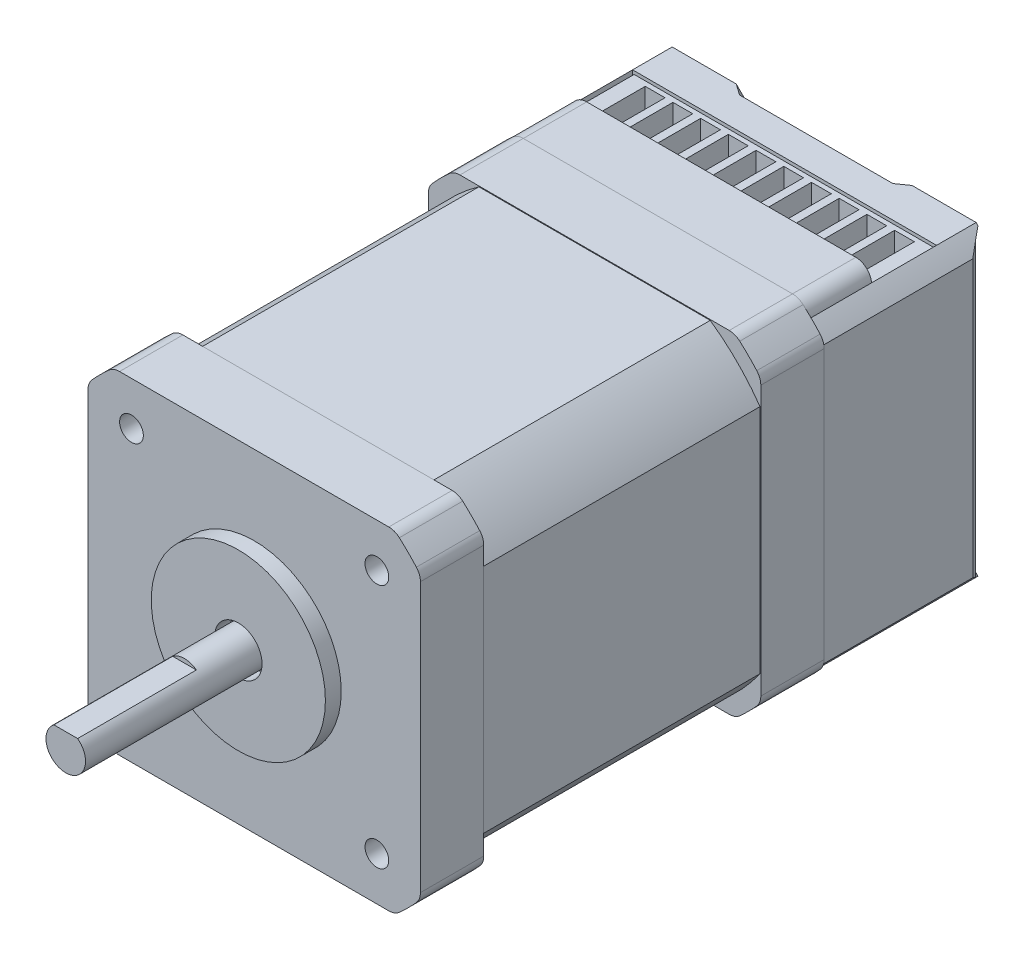
from build123d import *

# Parameters (mm, degrees)
SKIZZE1_W                            = 42
SKIZZE1_H                            = 42
AUFSATZ_LINEAR_AUSTRAGEN1_DEPTH      = 25.5
SKIZZE3_R                            = 11
SKIZZE3_R_2                          = 3
AUFSATZ_LINEAR_AUSTRAGEN2_DEPTH      = 2
SKIZZE5_R                            = 1.5
SCHNITT_LINEAR_AUSTRAGEN2_DEPTH      = 10
AUFSATZ_LINEAR_AUSTRAGEN3_DEPTH      = 21.8
AUFSATZ_LINEAR_AUSTRAGEN3_DEPTH_BACK = 10
SKIZZE6_R                            = 2.5
SKIZZE10_W                           = 14.352369787
SKIZZE10_H                           = 9.568246525
SCHNITT_LINEAR_AUSTRAGEN4_DEPTH      = 15
SKIZZE2_OUTSIDE_W                    = 63.102
SKIZZE2_OUTSIDE_H                    = 63.102
SKIZZE2_OUTSIDE_R                    = 27.5
SCHNITT_LINEAR_AUSTRAGEN5_DEPTH      = 60.016946719
SCHNITT_LINEAR_START                 = -8
SKIZZE11_R                           = 28.22533159
SCHNITT_LINEAR_AUSTRAGEN6_DEPTH      = 35
VERRUNDUNG1_R                        = 2
SKIZZE12_W                           = 38
SKIZZE12_H                           = 15
AUFSATZ_LINEAR_AUSTRAGEN4_DEPTH      = 8
VERRUNDUNG2_R                        = 2
SKIZZE13_W                           = 38
SKIZZE13_H                           = 13
AUFSATZ_LINEAR_AUSTRAGEN5_DEPTH      = 8
SKIZZE15_W                           = 2.5
SKIZZE15_H                           = 6.8
SCHNITT_LINEAR_AUSTRAGEN7_DEPTH      = 8
LINEARES_MUSTER1_COUNT               = 5
LINEARES_MUSTER1_PITCH               = 3.5
SPIEGELN1_COPY_1_SKETCH_W            = 2.5
SPIEGELN1_COPY_1_SKETCH_H            = 6.8
SPIEGELN1_COPY_1_DEPTH               = 8
SPIEGELN1_COPY_2_SKETCH_W            = 2.5
SPIEGELN1_COPY_2_SKETCH_H            = 6.8
SPIEGELN1_COPY_2_DEPTH               = 8
SPIEGELN1_COPY_3_SKETCH_W            = 2.5
SPIEGELN1_COPY_3_SKETCH_H            = 6.8
SPIEGELN1_COPY_3_DEPTH               = 8
SPIEGELN1_COPY_4_SKETCH_W            = 2.5
SPIEGELN1_COPY_4_SKETCH_H            = 6.8
SPIEGELN1_COPY_4_DEPTH               = 8
AUFSATZ_LINEAR_AUSTRAGEN6_DEPTH      = 16
AUFSATZ_LINEAR_AUSTRAGEN7_DEPTH      = 5
SCHNITT_LINEAR_AUSTRAGEN8_DEPTH      = 1
AUFSATZ_LINEAR_AUSTRAGEN8_DEPTH      = 1
SCHNITT_LINEAR_AUSTRAGEN9_DEPTH      = 1
FASE1_SIZE                           = 1
SCHNITT_LINEAR_AUSTRAGEN10_DEPTH     = 68.113738214
SKIZZE22_R                           = 3
SCHNITT_LINEAR_AUSTRAGEN11_DEPTH     = 2


with BuildPart() as part:
    # Skizze1 → Aufsatz-Linear austragen1 (new, symmetric)
    with BuildSketch(Plane.XY):
        Rectangle(SKIZZE1_W, SKIZZE1_H)
    extrude(amount=AUFSATZ_LINEAR_AUSTRAGEN1_DEPTH, both=True)

    # Skizze3 → Aufsatz-Linear austragen2 (add)
    with BuildSketch(Plane.XY.offset(25.5)):
        Circle(SKIZZE3_R)
        Circle(SKIZZE3_R_2, mode=Mode.SUBTRACT)
    extrude(amount=AUFSATZ_LINEAR_AUSTRAGEN2_DEPTH)

    # Skizze5 → Schnitt-Linear austragen2 (cut)
    with BuildSketch(Plane.XY.offset(25.5)):
        with Locations((-15.5, 15.5)):
            Circle(SKIZZE5_R)
        with Locations((15.5, 15.5)):
            Circle(SKIZZE5_R)
        with Locations((-15.5, -15.5)):
            Circle(SKIZZE5_R)
        with Locations((15.5, -15.5)):
            Circle(SKIZZE5_R)
    extrude(amount=-SCHNITT_LINEAR_AUSTRAGEN2_DEPTH, mode=Mode.SUBTRACT)

    # Skizze6 → Aufsatz-Linear austragen3 (add, two sides: drawn at the far end of the back side and taken through both)
    with BuildSketch(Plane.XY.offset(27.5).offset(-AUFSATZ_LINEAR_AUSTRAGEN3_DEPTH_BACK)):
        Circle(SKIZZE6_R)
    extrude(amount=AUFSATZ_LINEAR_AUSTRAGEN3_DEPTH + AUFSATZ_LINEAR_AUSTRAGEN3_DEPTH_BACK)

    # Skizze10 → Schnitt-Linear austragen4 (cut)
    with BuildSketch(Plane.XY.offset(49.3)):
        with Locations((0.401216994, 6.784123263)):
            Rectangle(SKIZZE10_W, SKIZZE10_H)
    extrude(amount=-SCHNITT_LINEAR_AUSTRAGEN4_DEPTH, mode=Mode.SUBTRACT)

    # Skizze2 outside → Schnitt-Linear austragen5 (cut, through all)
    with BuildSketch(Plane.XY.offset(25.5)):
        Rectangle(SKIZZE2_OUTSIDE_W, SKIZZE2_OUTSIDE_H)
        Circle(SKIZZE2_OUTSIDE_R, mode=Mode.SUBTRACT)
    extrude(amount=-SCHNITT_LINEAR_AUSTRAGEN5_DEPTH, mode=Mode.SUBTRACT)

    # Skizze11 → Schnitt-Linear austragen6 (cut)
    with BuildSketch(Plane.XY.offset(25.5).offset(SCHNITT_LINEAR_START)):
        Circle(SKIZZE11_R)
        with BuildLine():
            Line((-14.609585894, 20.9), (14.609585894, 20.9))
            ThreePointArc((14.609585894, 20.9), (18.03122292, 18.03122292), (20.9, 14.609585894))
            Line((20.9, 14.609585894), (20.9, -14.609585894))
            ThreePointArc((20.9, -14.609585894), (18.03122292, -18.03122292), (14.609585894, -20.9))
            Line((14.609585894, -20.9), (-14.609585894, -20.9))
            ThreePointArc((-14.609585894, -20.9), (-18.03122292, -18.03122292), (-20.9, -14.609585894))
            Line((-20.9, -14.609585894), (-20.9, 14.609585894))
            ThreePointArc((-20.9, 14.609585894), (-18.03122292, 18.03122292), (-14.609585894, 20.9))
        make_face(mode=Mode.SUBTRACT)
    extrude(amount=-SCHNITT_LINEAR_AUSTRAGEN6_DEPTH, mode=Mode.SUBTRACT)

    # Verrundung1
    verrundung1_edges = [part.edges().sort_by_distance(p)[0] for p in [
        (-17.755280905, 21, -21.5),
        (-21, 17.755280905, 21.5),
        (21, 17.755280905, -21.5),
        (17.755280905, 21, 21.5),
        (21, -17.755280905, 21.5),
        (17.755280905, -21, -21.5),
        (-21, -17.755280905, -21.5),
        (-17.755280905, -21, 21.5),
        (21, -17.755280905, -21.5),
        (21, 17.755280905, 21.5),
        (17.755280905, 21, -21.5),
        (-17.755280905, 21, 21.5),
        (-21, 17.755280905, -21.5),
        (-21, -17.755280905, 21.5),
        (-17.755280905, -21, -21.5),
        (17.755280905, -21, 21.5),
    ]]
    fillet(verrundung1_edges, radius=VERRUNDUNG1_R)


with BuildPart() as body_2:
    # Skizze12 → Aufsatz-Linear austragen4 (new body)
    with BuildSketch(Plane(origin=(0, 0, -25.5), x_dir=(-1, 0, 0), z_dir=(0, 0, -1))):
        with Locations((0, 13.5)):
            Rectangle(SKIZZE12_W, SKIZZE12_H)
    extrude(amount=AUFSATZ_LINEAR_AUSTRAGEN4_DEPTH)

    # Verrundung2
    verrundung2_edges = [body_2.edges().sort_by_distance(p)[0] for p in [
        (19, 21, -29.5),
        (-19, 21, -29.5),
    ]]
    fillet(verrundung2_edges, radius=VERRUNDUNG2_R)


with BuildPart() as body_3:
    # Skizze13 → Aufsatz-Linear austragen5 (new body)
    with BuildSketch(Plane(origin=(0, 0, -33.5), x_dir=(-1, 0, 0), z_dir=(0, 0, -1))):
        with Locations((0, 12.5)):
            Rectangle(SKIZZE13_W, SKIZZE13_H)
    extrude(amount=AUFSATZ_LINEAR_AUSTRAGEN5_DEPTH)

    # Skizze15 → Schnitt-Linear austragen7 (cut)
    with BuildSketch(Plane(origin=(0, 19, 0), x_dir=(1, 0, 0), z_dir=(0, 1, 0))):
        with Locations((1.75, 37.5)):
            Rectangle(SKIZZE15_W, SKIZZE15_H)
    schnitt_linear_austragen7 = extrude(amount=-SCHNITT_LINEAR_AUSTRAGEN7_DEPTH, mode=Mode.SUBTRACT)

    # Lineares Muster1: Schnitt-Linear austragen7 ×5
    with Locations(*[(i * LINEARES_MUSTER1_PITCH, 0, 0) for i in range(1, LINEARES_MUSTER1_COUNT)]):
        add(schnitt_linear_austragen7, mode=Mode.SUBTRACT)

    # Spiegeln1: Schnitt-Linear austragen7 across plane
    add(schnitt_linear_austragen7.mirror(Plane(origin=(0, 0, 0), x_dir=(0, 0, 1), z_dir=(1, 0, 0))), mode=Mode.SUBTRACT)

    # Spiegeln1 copy 1 sketch → Spiegeln1 copy 1 (cut)
    with BuildSketch(Plane(origin=(-3.5, 19, 0), x_dir=(-1, 0, 0), z_dir=(0, 1, 0))):
        with Locations((1.75, -37.5)):
            Rectangle(SPIEGELN1_COPY_1_SKETCH_W, SPIEGELN1_COPY_1_SKETCH_H)
    extrude(amount=-SPIEGELN1_COPY_1_DEPTH, mode=Mode.SUBTRACT)

    # Spiegeln1 copy 2 sketch → Spiegeln1 copy 2 (cut)
    with BuildSketch(Plane(origin=(-7, 19, 0), x_dir=(-1, 0, 0), z_dir=(0, 1, 0))):
        with Locations((1.75, -37.5)):
            Rectangle(SPIEGELN1_COPY_2_SKETCH_W, SPIEGELN1_COPY_2_SKETCH_H)
    extrude(amount=-SPIEGELN1_COPY_2_DEPTH, mode=Mode.SUBTRACT)

    # Spiegeln1 copy 3 sketch → Spiegeln1 copy 3 (cut)
    with BuildSketch(Plane(origin=(-10.5, 19, 0), x_dir=(-1, 0, 0), z_dir=(0, 1, 0))):
        with Locations((1.75, -37.5)):
            Rectangle(SPIEGELN1_COPY_3_SKETCH_W, SPIEGELN1_COPY_3_SKETCH_H)
    extrude(amount=-SPIEGELN1_COPY_3_DEPTH, mode=Mode.SUBTRACT)

    # Spiegeln1 copy 4 sketch → Spiegeln1 copy 4 (cut)
    with BuildSketch(Plane(origin=(-14, 19, 0), x_dir=(-1, 0, 0), z_dir=(0, 1, 0))):
        with Locations((1.75, -37.5)):
            Rectangle(SPIEGELN1_COPY_4_SKETCH_W, SPIEGELN1_COPY_4_SKETCH_H)
    extrude(amount=-SPIEGELN1_COPY_4_DEPTH, mode=Mode.SUBTRACT)



with BuildPart() as body_4:
    # Skizze16 → Aufsatz-Linear austragen6 (new body)
    with BuildSketch(Plane(origin=(0, 0, -25.5), x_dir=(-1, 0, 0), z_dir=(0, 0, -1))):
        with BuildLine():
            Line((-19.2, 19.407472788), (-19.2, 5.707374331))
            Line((-19.2, 5.707374331), (19.2, 5.707374331))
            Line((19.2, 5.707374331), (19.2, 19.407472788))
            ThreePointArc((19.2, 19.407472788), (20.123963193, 18.447658534), (21, 17.443910112))
            Line((21, 17.443910112), (21, -17.443910112))
            ThreePointArc((21, -17.443910112), (19.304015126, -19.304015126), (17.443910112, -21))
            Line((17.443910112, -21), (-17.443910112, -21))
            ThreePointArc((-17.443910112, -21), (-19.304015126, -19.304015126), (-21, -17.443910112))
            Line((-21, -17.443910112), (-21, 17.443910112))
            ThreePointArc((-21, 17.443910112), (-20.123963193, 18.447658534), (-19.2, 19.407472788))
        make_face()
    extrude(amount=AUFSATZ_LINEAR_AUSTRAGEN6_DEPTH)


with BuildPart() as body_3_1:
    add(body_3.part)

    add(body_4.part)  # Aufsatz-Linear austragen7 merges body 4
    # Skizze17 → Aufsatz-Linear austragen7 (add)
    with BuildSketch(Plane(origin=(0, 0, -41.5), x_dir=(-1, 0, 0), z_dir=(0, 0, -1))):
        with BuildLine():
            Line((-19.2, 19.407472788), (19.2, 19.407472788))
            ThreePointArc((19.2, 19.407472788), (20.123963193, 18.447658534), (21, 17.443910112))
            Line((21, 17.443910112), (21, -17.443910112))
            ThreePointArc((21, -17.443910112), (19.304015126, -19.304015126), (17.443910112, -21))
            Line((17.443910112, -21), (-17.443910112, -21))
            ThreePointArc((-17.443910112, -21), (-19.304015126, -19.304015126), (-21, -17.443910112))
            Line((-21, -17.443910112), (-21, 17.443910112))
            ThreePointArc((-21, 17.443910112), (-20.123963193, 18.447658534), (-19.2, 19.407472788))
        make_face()
    extrude(amount=AUFSATZ_LINEAR_AUSTRAGEN7_DEPTH)

    # Skizze18 → Schnitt-Linear austragen8 (cut)
    with BuildSketch(Plane(origin=(0, 0, -46.5), x_dir=(-1, 0, 0), z_dir=(0, 0, -1))):
        with BuildLine():
            Line((5.221122562, 2.334373984), (5.221122562, -9.553971573))
            ThreePointArc((5.221122562, -9.553971573), (4.489595038, -12.219240265), (2.5, -14.137651406))
            Line((2.5, -14.137651406), (2.5, -14.933283778))
            Line((2.5, -14.933283778), (8.566716222, -21))
            Line((8.566716222, -21), (-8.566716222, -21))
            Line((-8.566716222, -21), (-2.5, -14.933283778))
            Line((-2.5, -14.933283778), (-2.5, -14.137651406))
            ThreePointArc((-2.5, -14.137651406), (-4.489595038, -12.219240265), (-5.221122562, -9.553971573))
            Line((-5.221122562, -9.553971573), (-5.221122562, 2.334373984))
            ThreePointArc((-5.221122562, 2.334373984), (-4.489595038, 4.999642676), (-2.5, 6.918053817))
            Line((-2.5, 6.918053817), (-2.5, 12.218156322))
            Line((-2.5, 12.218156322), (-9.689316465, 19.407472788))
            Line((-9.689316465, 19.407472788), (9.689316465, 19.407472788))
            Line((9.689316465, 19.407472788), (2.5, 12.218156322))
            Line((2.5, 12.218156322), (2.5, 6.918053817))
            ThreePointArc((2.5, 6.918053817), (4.489595038, 4.999642676), (5.221122562, 2.334373984))
        make_face()
    extrude(amount=-SCHNITT_LINEAR_AUSTRAGEN8_DEPTH, mode=Mode.SUBTRACT)

    # Skizze19 → Aufsatz-Linear austragen8 (add)
    with BuildSketch(Plane(origin=(0, 0, -45.5), x_dir=(-1, 0, 0), z_dir=(0, 0, -1))):
        with BuildLine():
            Line((-0.773813228, 7.978989317), (-0.773813228, 11.016994269))
            ThreePointArc((-0.773813228, 11.016994269), (0, 11.790807497), (0.773813228, 11.016994269))
            Line((0.773813228, 11.016994269), (0.773813228, 7.978989317))
            ThreePointArc((0.773813228, 7.978989317), (0, 7.20517609), (-0.773813228, 7.978989317))
        make_face()
    extrude(amount=AUFSATZ_LINEAR_AUSTRAGEN8_DEPTH)

    # Skizze20 → Schnitt-Linear austragen9 (cut)
    with BuildSketch(Plane(origin=(0, 0, -46.5), x_dir=(-1, 0, 0), z_dir=(0, 0, -1))):
        Polygon((-11.644380446, 10.674415981), (-11.644380446, -9.968075788), (-20.123963193, -18.447658534), (-24.141940887, -18.447658534), (-24.141940887, 18.447658534), (-20.123963193, 18.447658534), align=None)
    schnitt_linear_austragen9 = extrude(amount=-SCHNITT_LINEAR_AUSTRAGEN9_DEPTH, mode=Mode.SUBTRACT)

    # Spiegeln2: Schnitt-Linear austragen9 across plane
    add(schnitt_linear_austragen9.mirror(Plane(origin=(0, 0, 0), x_dir=(0, 0, 1), z_dir=(1, 0, 0))), mode=Mode.SUBTRACT)

    # Fase1
    fase1_edges = [body_3_1.edges().sort_by_distance(p)[0] for p in [
        (15.88417182, -14.207867161, -46.5),
    ]]
    chamfer(fase1_edges, length=FASE1_SIZE - 0.0001)  # a hair under: the kernel refuses the full size
    fase1_2_edges = [body_3_1.edges().sort_by_distance(p)[0] for p in [
        (5.533358111, -17.966641889, -46.5),
    ]]
    chamfer(fase1_2_edges, length=FASE1_SIZE - 0.0001)  # a hair under: the kernel refuses the full size
    fase1_3_edges = [body_3_1.edges().sort_by_distance(p)[0] for p in [
        (4.600407561, -12.023054617, -46.5),
        (5.221122562, -3.609798794, -46.5),
        (4.489595038, 4.999642676, -46.5),
    ]]
    chamfer(fase1_3_edges, length=FASE1_SIZE - 0.0001)  # a hair under: the kernel refuses the full size
    fase1_4_edges = [body_3_1.edges().sort_by_distance(p)[0] for p in [
        (2.5, 10.124559455, -46.5),
    ]]
    chamfer(fase1_4_edges, length=FASE1_SIZE - 0.0001)  # a hair under: the kernel refuses the full size
    fase1_5_edges = [body_3_1.edges().sort_by_distance(p)[0] for p in [
        (6.594608233, 16.312764555, -46.5),
    ]]
    chamfer(fase1_5_edges, length=FASE1_SIZE - 0.0001)  # a hair under: the kernel refuses the full size
    fase1_6_edges = [body_3_1.edges().sort_by_distance(p)[0] for p in [
        (15.88417182, 14.561037258, -46.5),
    ]]
    chamfer(fase1_6_edges, length=FASE1_SIZE - 0.0001)  # a hair under: the kernel refuses the full size
    fase1_7_edges = [body_3_1.edges().sort_by_distance(p)[0] for p in [
        (11.644380446, 0.353170097, -46.5),
    ]]
    chamfer(fase1_7_edges, length=FASE1_SIZE - 0.0001)  # a hair under: the kernel refuses the full size
    fase1_8_edges = [body_3_1.edges().sort_by_distance(p)[0] for p in [
        (-5.533358111, -17.966641889, -46.5),
    ]]
    chamfer(fase1_8_edges, length=FASE1_SIZE - 0.0001)  # a hair under: the kernel refuses the full size
    fase1_9_edges = [body_3_1.edges().sort_by_distance(p)[0] for p in [
        (-15.88417182, -14.207867161, -46.5),
    ]]
    chamfer(fase1_9_edges, length=FASE1_SIZE - 0.0001)  # a hair under: the kernel refuses the full size
    fase1_10_edges = [body_3_1.edges().sort_by_distance(p)[0] for p in [
        (-11.644380446, 0.353170097, -46.5),
    ]]
    chamfer(fase1_10_edges, length=FASE1_SIZE - 0.0001)  # a hair under: the kernel refuses the full size
    fase1_11_edges = [body_3_1.edges().sort_by_distance(p)[0] for p in [
        (-15.88417182, 14.561037258, -46.5),
    ]]
    chamfer(fase1_11_edges, length=FASE1_SIZE - 0.0004)  # a hair under: the kernel refuses the full size
    fase1_12_edges = [body_3_1.edges().sort_by_distance(p)[0] for p in [
        (-6.094658233, 15.812814555, -46.5),
    ]]
    chamfer(fase1_12_edges, length=FASE1_SIZE - 0.0001)  # a hair under: the kernel refuses the full size
    fase1_13_edges = [body_3_1.edges().sort_by_distance(p)[0] for p in [
        (-2.5, 8.861068999, -46.5),
    ]]
    chamfer(fase1_13_edges, length=FASE1_SIZE - 0.0001)  # a hair under: the kernel refuses the full size
    fase1_14_edges = [body_3_1.edges().sort_by_distance(p)[0] for p in [
        (-4.77145301, 4.454127974, -46.5),
        (-5.221122562, -3.609798794, -46.5),
        (-4.600407561, -12.023054617, -46.5),
    ]]
    chamfer(fase1_14_edges, length=FASE1_SIZE - 0.0001)  # a hair under: the kernel refuses the full size

    # Skizze21 → Schnitt-Linear austragen10 (cut, through all)
    with BuildSketch(Plane(origin=(0, 19.407472788, 0), x_dir=(1, 0, 0), z_dir=(0, 1, 0))):
        Polygon((19.434719493, 46.5), (21.463760795, 43.612745604), (21.463760795, 46.5), align=None)
        Polygon((-19.434719493, 46.5), (-21.350982399, 43.773225295), (-21.350982399, 46.5), align=None)
    extrude(amount=-SCHNITT_LINEAR_AUSTRAGEN10_DEPTH, mode=Mode.SUBTRACT)

    # Skizze22 → Schnitt-Linear austragen11 (cut)
    with BuildSketch(Plane(origin=(0, 0, -46.5), x_dir=(-1, 0, 0), z_dir=(0, 0, -1))):
        with Locations((-15.818432524, 4.576251415)):
            Circle(SKIZZE22_R)
        with Locations((16.158502976, -12.029796634)):
            Circle(SKIZZE22_R)
    extrude(amount=-SCHNITT_LINEAR_AUSTRAGEN11_DEPTH, mode=Mode.SUBTRACT)


solid = Compound([part.part, body_2.part, body_3_1.part])
